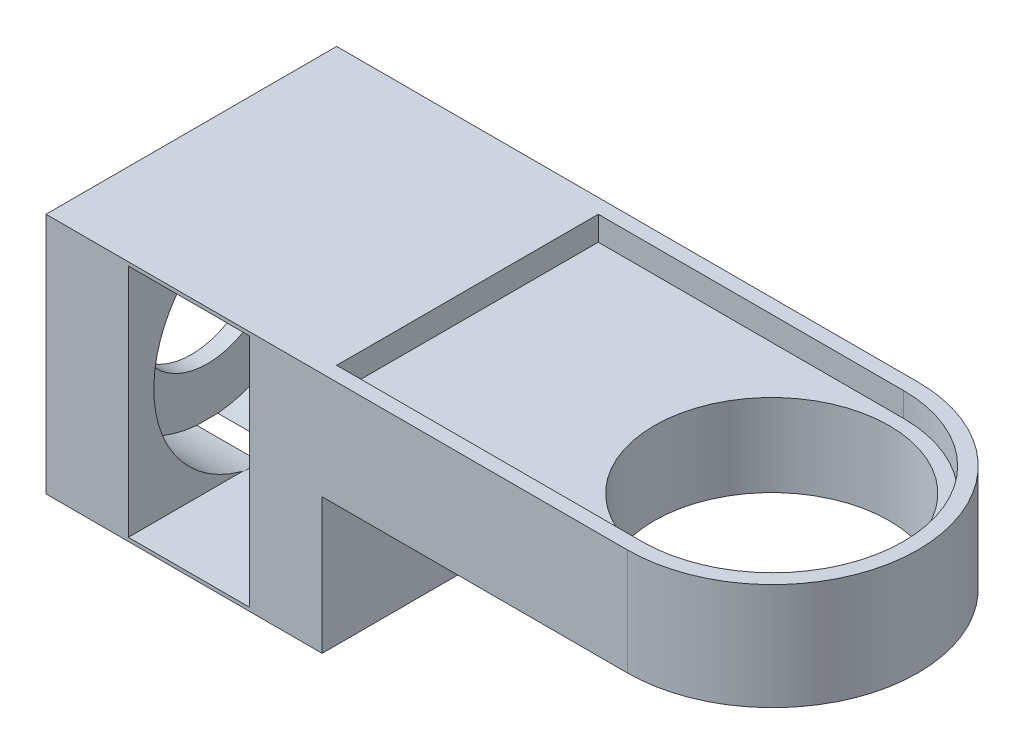
from build123d import *

# Parameters (mm, degrees)
SKETCH_1_W          = 300
SKETCH_1_H          = 120
SKETCH_1_R          = 48.5
EXTRUDE_1_DEPTH     = 34
FILLET_2_RADIUS     = 60
FILLET_2_LENGTH     = 34
EXTRUDE_4_DEPTH     = 10
FILLET_3_R          = 54
EXTRUDE_START       = -144
EXTRUDE_5_OUTLINE_W = 10
EXTRUDE_5_OUTLINE_H = 108
EXTRUDE_5_DEPTH     = 108
SKETCH_17_W         = 114
SKETCH_17_H         = 120
EXTRUDE_9_DEPTH     = 56
SKETCH_18_W         = 50
SKETCH_18_H         = 97
CUT_EXTRUDE_1_DEPTH = 201.089979759
SKETCH_20_R         = 29.5
CUT_EXTRUDE_2_DEPTH = 6.6
SKETCH_21_R         = 49.5
CUT_EXTRUDE_3_DEPTH = 27.7


# Read off the part's stored shape, not the designer's step: 凸台-拉伸5
with BuildPart() as part:
    # 草图1 → 凸台-拉伸1 (new body)
    with BuildSketch(Plane(origin=(0, 0, 0), x_dir=(1, 0, 0), z_dir=(0, 1, 0))):
        Rectangle(SKETCH_1_W, SKETCH_1_H)
        with Locations(Location((89.61415623, 0, 0), (0, 0, 270))):
            Circle(SKETCH_1_R, mode=Mode.SUBTRACT)
    extrude(amount=EXTRUDE_1_DEPTH)

    # 圆角2: full round fillet: the end face becomes a half cylinder, R = half its width
    fillet_2_face = Plane((150, 17, 0), x_dir=(0, -1, 0), z_dir=(1, 0, 0))  # on the end face: x along it, z out of the body
    fillet_2_slab = fillet_2_face.offset(-FILLET_2_RADIUS / 2) * Box(FILLET_2_LENGTH, 2 * FILLET_2_RADIUS, FILLET_2_RADIUS, mode=Mode.PRIVATE)  # the body's end, R deep
    fillet_2_round = Plane((90, 17, 0), x_dir=(1, 0, 0), z_dir=(0, -1, 0)) * Cylinder(FILLET_2_RADIUS, FILLET_2_LENGTH, mode=Mode.PRIVATE)  # its axis R under the face
    add(fillet_2_slab - fillet_2_round, mode=Mode.SUBTRACT)

    # 草图3 → 凸台-拉伸4 (add)
    with BuildSketch(Plane(origin=(0, 34, 0), x_dir=(1, 0, 0), z_dir=(0, 1, 0))):
        with BuildLine():
            Line((-150, -60), (90, -60))
            ThreePointArc((90, -60), (150, 0), (90, 60))
            Line((90, 60), (-150, 60))
            Line((-150, 60), (-150, -60))
        make_face()
        with BuildLine():
            Line((-144, -54), (90, -54))
            ThreePointArc((90, -54), (144, 0), (90, 54))
            Line((90, 54), (-144, 54))
            Line((-144, 54), (-144, -54))
        make_face(mode=Mode.SUBTRACT)
    extrude(amount=EXTRUDE_4_DEPTH)

    # 圆角3
    fillet_3_edges = [part.edges().sort_by_distance(p)[0] for p in [
        (-144, 39, 54),
        (-144, 39, -54),
    ]]
    fillet(fillet_3_edges, radius=FILLET_3_R - 0.0001)  # a hair under: the kernel refuses the full size

    # 凸台-拉伸5 outline → 凸台-拉伸5 (add)
    with BuildSketch(Plane.YZ.offset(EXTRUDE_START)):
        with Locations((39, 0)):
            Rectangle(EXTRUDE_5_OUTLINE_W, EXTRUDE_5_OUTLINE_H)
    extrude(amount=EXTRUDE_5_DEPTH)

    # 草图17 → 凸台-拉伸9 (add)
    with BuildSketch(Plane.XZ):
        with Locations((-93, 0)):
            Rectangle(SKETCH_17_W, SKETCH_17_H)
    extrude(amount=EXTRUDE_9_DEPTH)

    # 草图18 → 切除-拉伸1 (cut, through all)
    with BuildSketch(Plane(origin=(0, 0, -60), x_dir=(-1, 0, 0), z_dir=(0, 0, -1))):
        with Locations((91, -6)):
            Rectangle(SKETCH_18_W, SKETCH_18_H)
    extrude(amount=-CUT_EXTRUDE_1_DEPTH, mode=Mode.SUBTRACT)

    # 草图20 → 切除-拉伸2 (cut)
    with BuildSketch(Plane.ZY.offset(150)):
        with Locations((0, -6.689787926)):
            Circle(SKETCH_20_R)
    extrude(amount=-CUT_EXTRUDE_2_DEPTH, mode=Mode.SUBTRACT)

    # 草图21 → 切除-拉伸3 (cut)
    with BuildSketch(Plane.ZY.offset(143.4)):
        with Locations((0, -6.689787926)):
            Circle(SKETCH_21_R)
    extrude(amount=-CUT_EXTRUDE_3_DEPTH, mode=Mode.SUBTRACT)


solid = part.part
